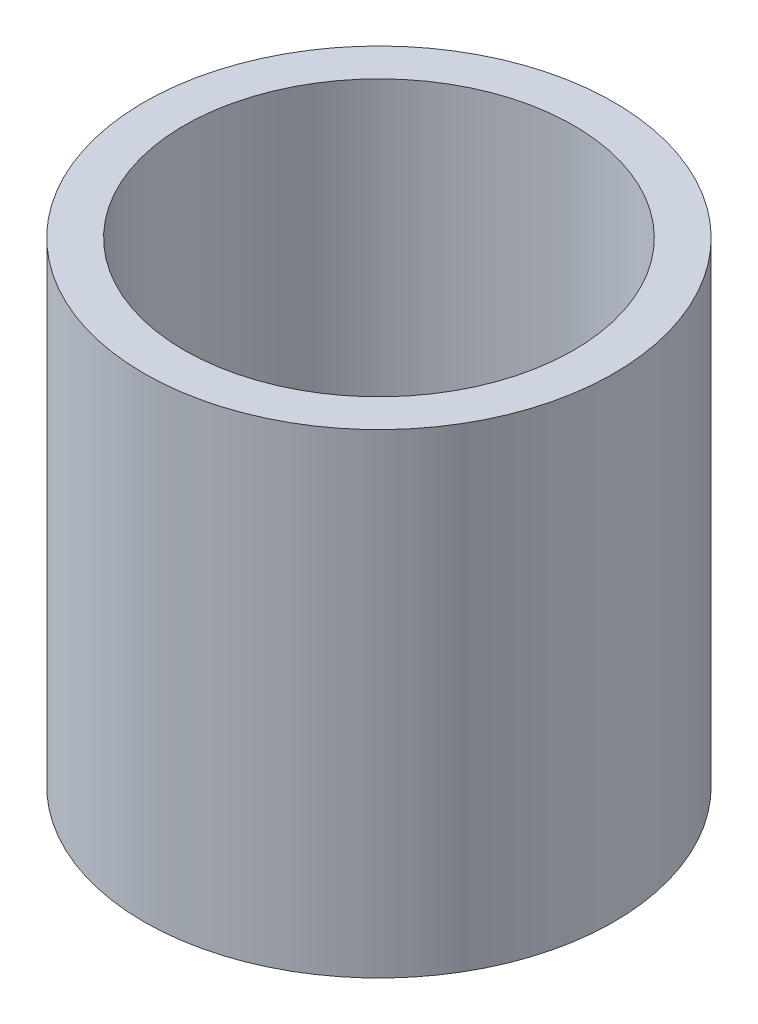
from build123d import *

# Parameters (mm, degrees)
SKETCH1_R           = 17.5
BOSS_EXTRUDE1_DEPTH = 35.378220723
SKETCH2_R           = 14.504972783
CUT_EXTRUDE1_DEPTH  = 44.175438637


with BuildPart() as part:
    # Sketch1 → Boss-Extrude1 (new body)
    with BuildSketch(Plane(origin=(0, 0, 0), x_dir=(1, 0, 0), z_dir=(0, 1, 0))):
        Circle(SKETCH1_R)
    extrude(amount=BOSS_EXTRUDE1_DEPTH)

    # Sketch2 → Cut-Extrude1 (cut, through all)
    with BuildSketch(Plane(origin=(0, 0, 0), x_dir=(1, 0, 0), z_dir=(0, 1, 0))):
        Circle(SKETCH2_R)
    extrude(amount=CUT_EXTRUDE1_DEPTH, mode=Mode.SUBTRACT)


solid = part.part
